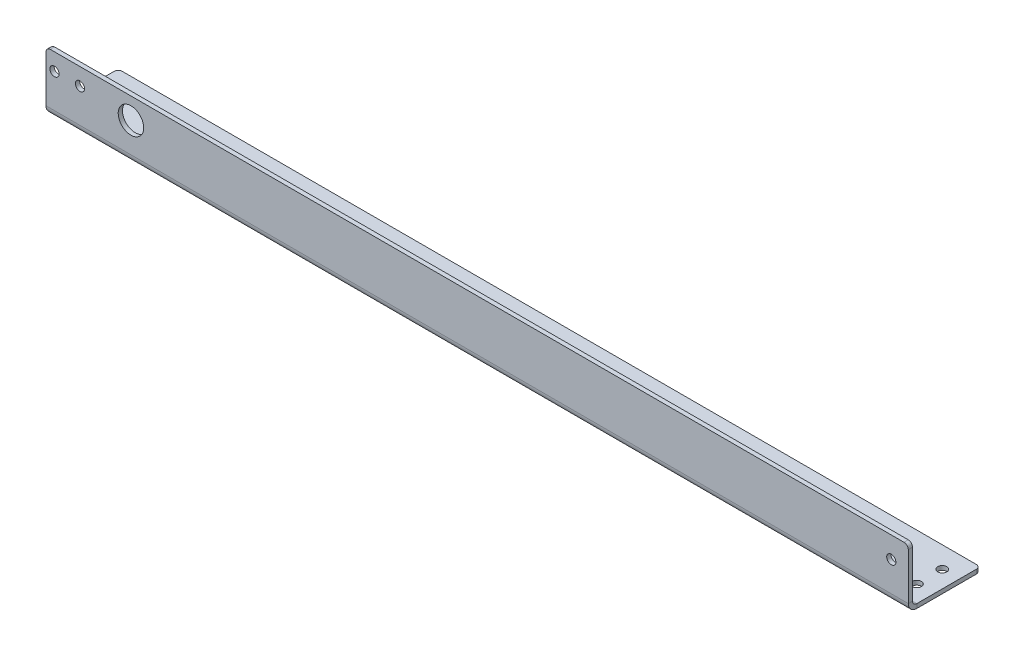
from build123d import *

# Parameters (mm, degrees)
BASE_FLANGE1_DEPTH = 644.525
SKETCH3_R          = 3.429
CUT_EXTRUDE1_DEPTH = 3.175
SKETCH5_R          = 3.429
SKETCH5_R_2        = 9.525
CUT_EXTRUDE2_DEPTH = 3.175
FILLET1_R          = 3.175


# Read off the part's stored shape, not the designer's step: Base-Flange1
with BuildPart() as part:
    # Base-Flange1 outline → Base-Flange1 (new body)
    with BuildSketch(Plane(origin=(0, 0, 0), x_dir=(0, 0, -1), z_dir=(1, 0, 0))):
        with BuildLine():
            Line((3.175, 6.35), (3.175, 44.45))
            Line((3.175, 44.45), (0, 44.45))
            Line((0, 44.45), (0, 6.35))
            ThreePointArc((0, 6.35), (1.859871939, 1.859871939), (6.35, 0))
            Line((6.35, 0), (53.975, 0))
            Line((53.975, 0), (53.975, 3.175))
            Line((53.975, 3.175), (6.35, 3.175))
            ThreePointArc((6.35, 3.175), (4.10493597, 4.10493597), (3.175, 6.35))
        make_face()
    extrude(amount=BASE_FLANGE1_DEPTH)

    # Sketch3 → Cut-Extrude1 (cut)
    with BuildSketch(Plane.XZ):
        with Locations(Location((631.825, -19.05, 0), (0, 0, 270))):
            Circle(SKETCH3_R)
        with Locations(Location((631.825, -38.1, 0), (0, 0, 270))):
            Circle(SKETCH3_R)
        with Locations(Location((12.7, -38.1, 0), (0, 0, 270))):
            Circle(SKETCH3_R)
        with Locations(Location((12.7, -19.05, 0), (0, 0, 270))):
            Circle(SKETCH3_R)
    extrude(amount=-CUT_EXTRUDE1_DEPTH, mode=Mode.SUBTRACT)

    # Sketch5 → Cut-Extrude2 (cut)
    with BuildSketch(Plane.XY):
        with Locations((631.825, 28.575)):
            Circle(SKETCH5_R)
        with Locations((6.35, 31.75)):
            Circle(SKETCH5_R)
        with Locations((63.5, 28.575)):
            Circle(SKETCH5_R_2)
        with Locations((25.4, 31.75)):
            Circle(SKETCH5_R)
    extrude(amount=-CUT_EXTRUDE2_DEPTH, mode=Mode.SUBTRACT)

    # Fillet1
    fillet1_edges = [part.edges().sort_by_distance(p)[0] for p in [
        (644.525, 1.5875, -53.975),
        (0, 1.5875, -53.975),
        (644.525, 44.45, -1.5875),
        (0, 44.45, -1.5875),
    ]]
    fillet(fillet1_edges, radius=FILLET1_R)


solid = part.part
